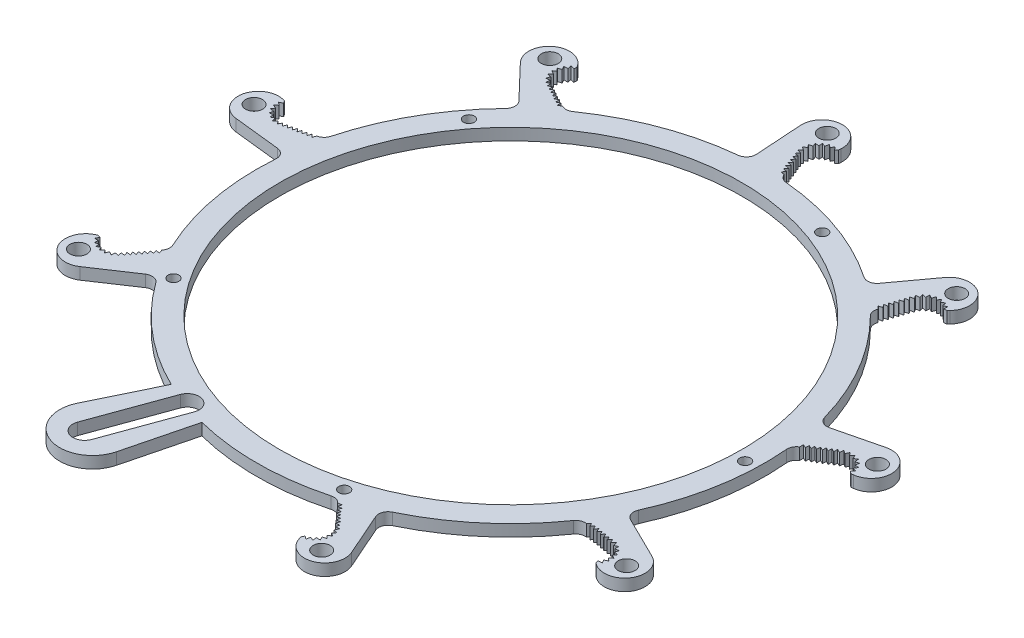
from build123d import *

# Parameters (mm, degrees)
SKETCH1_R           = 68.58
SKETCH1_R_2         = 55.88
BOSS_EXTRUDE1_DEPTH = 3.175
BOSS_EXTRUDE2_START = -3.175
BOSS_EXTRUDE2_DEPTH = 3.175
CIRPATTERN1_COUNT   = 9
SKETCH4_R           = 1.27
CUT_EXTRUDE1_DEPTH  = 126.612114435
CIRPATTERN14_COUNT  = 4
SKETCH5_R           = 62.357
CUT_EXTRUDE2_DEPTH  = 126.612114435
SKETCH7_R           = 1.4605
CUT_EXTRUDE4_DEPTH  = 126.612114435
CIRPATTERN16_COUNT  = 5
CUT_EXTRUDE5_DEPTH  = 126.612114435
CRVPATTERN1_DEPTH   = 3.175
CIRPATTERN17_COUNT  = 9
BOSS_EXTRUDE5_START = -3.175
BOSS_EXTRUDE5_DEPTH = 3.175
SKETCH3_R           = 2.286
CUT_EXTRUDE7_DEPTH  = 126.612114435
CIRPATTERN18_COUNT  = 9
BOSS_EXTRUDE6_START = -3.175
BOSS_EXTRUDE6_DEPTH = 3.175
CUT_EXTRUDE8_DEPTH  = 128.151801464


# Read off the part's stored shape, not the designer's step: CrvPattern1
with BuildPart() as part:
    # Sketch1 → Boss-Extrude1 (new body)
    with BuildSketch(Plane(origin=(0, 0, 0), x_dir=(1, 0, 0), z_dir=(0, 1, 0))):
        with Locations(Location((0, 0, 0), (0, 0, 270))):
            Circle(SKETCH1_R)
        with Locations(Location((0, 0, 0), (0, 0, 270))):
            Circle(SKETCH1_R_2, mode=Mode.SUBTRACT)
    extrude(amount=BOSS_EXTRUDE1_DEPTH)

    # Sketch2 → Boss-Extrude2 (add)
    with BuildSketch(Plane(origin=(0, 3.175, 0), x_dir=(1, 0, 0), z_dir=(0, 1, 0)).offset(BOSS_EXTRUDE2_START)):
        with BuildLine():
            Line((-4.648503105, 70.922452149), (-5.395010683, 82.311956847))
            Line((-5.395010683, 82.311956847), (-5.478072657, 83.579237679))
            ThreePointArc((-5.478072657, 83.579237679), (0, 89.428116328), (5.478072657, 83.579237679))
            Line((5.478072657, 83.579237679), (5.395010683, 82.311956847))
            ThreePointArc((5.395010683, 82.311956847), (1.617293808, 81.120206155), (0.93984527, 77.217325427))
            Line((0.93984527, 77.217325427), (3.81, 69.921657137))
            ThreePointArc((3.81, 69.921657137), (4.653834894, 68.816417694), (5.953179428, 68.321124513))
            ThreePointArc((5.953179428, 68.321124513), (-0.488833742, 68.57825779), (-6.926526743, 68.22931648))
            ThreePointArc((-6.926526743, 68.22931648), (-5.243785443, 69.115963701), (-4.648503105, 70.922452149))
        make_face()
    boss_extrude2 = extrude(amount=BOSS_EXTRUDE2_DEPTH)

    # CirPattern1: Boss-Extrude2 ×9 about axis
    cirpattern1_axis = Axis((0, 0, 0), (0, 1, 0))
    for i in range(1, CIRPATTERN1_COUNT):
        add(boss_extrude2.rotate(cirpattern1_axis, i * 360 / CIRPATTERN1_COUNT))

    # Sketch4 → Cut-Extrude1 (cut, through all)
    with BuildSketch(Plane(origin=(0, 3.175, 0), x_dir=(1, 0, 0), z_dir=(0, 1, 0))):
        with Locations(Location((41.758190963, 41.758190963, 0), (0, 0, 270))):
            Circle(SKETCH4_R)
    cut_extrude1 = extrude(amount=-CUT_EXTRUDE1_DEPTH, mode=Mode.SUBTRACT)

    # CirPattern14: Cut-Extrude1 ×4 about axis
    cirpattern14_axis = Axis((0, 0, 0), (0, 1, 0))
    for i in range(1, CIRPATTERN14_COUNT):
        add(cut_extrude1.rotate(cirpattern14_axis, i * 360 / CIRPATTERN14_COUNT), mode=Mode.SUBTRACT)

    # Sketch5 → Cut-Extrude2 (cut, through all)
    with BuildSketch(Plane(origin=(0, 3.175, 0), x_dir=(1, 0, 0), z_dir=(0, 1, 0))):
        with Locations(Location((0, 0, 0), (0, 0, 270))):
            Circle(SKETCH5_R)
    extrude(amount=-CUT_EXTRUDE2_DEPTH, mode=Mode.SUBTRACT)

    # Sketch7 → Cut-Extrude4 (cut, through all)
    with BuildSketch(Plane(origin=(0, 3.175, 0), x_dir=(1, 0, 0), z_dir=(0, 1, 0))):
        with Locations(Location((22.413264032, 61.579936825, 0), (0, 0, 270))):
            Circle(SKETCH7_R)
    cut_extrude4 = extrude(amount=-CUT_EXTRUDE4_DEPTH, mode=Mode.SUBTRACT)

    # CirPattern16: Cut-Extrude4 ×5 about axis
    cirpattern16_axis = Axis((0, 0, 0), (0, 1, 0))
    for i in range(1, CIRPATTERN16_COUNT):
        add(cut_extrude4.rotate(cirpattern16_axis, i * 360 / CIRPATTERN16_COUNT), mode=Mode.SUBTRACT)

    # Sketch9 → Cut-Extrude5 (cut, through all)
    with BuildSketch(Plane(origin=(0, 3.175, 0), x_dir=(1, 0, 0), z_dir=(0, 1, 0))):
        Polygon((3.492302411, 71.076120273), (3.957242109, 69.894286496), (2.779305238, 70.113251627), align=None)
    cut_extrude5 = extrude(amount=-CUT_EXTRUDE5_DEPTH, mode=Mode.SUBTRACT)

    # CrvPattern1 outline → CrvPattern1 (cut)
    with BuildSketch(Plane(origin=(0, 0, 0), x_dir=(1, 0, 0), z_dir=(0, 1, 0))):
        with BuildLine():
            Line((0.940711797, 77.166791582), (0.329256214, 76.341050005))
            Line((0.329256214, 76.341050005), (1.359950976, 76.149455515))
            Line((1.359950976, 76.149455515), (0.93984527, 77.217325427))
            ThreePointArc((0.93984527, 77.217325427), (1.617293808, 81.120206155), (5.395010683, 82.311956847))
            Line((5.395010683, 82.311956847), (5.44100327, 83.013668123))
            Line((5.44100327, 83.013668123), (4.84878437, 82.438133766))
            Line((4.84878437, 82.438133766), (4.242655964, 83.304873176))
            Line((4.242655964, 83.304873176), (3.729171189, 82.380231497))
            Line((3.729171189, 82.380231497), (2.898698206, 83.03516926))
            Line((2.898698206, 83.03516926), (2.673905231, 82.001681492))
            Line((2.673905231, 82.001681492), (1.689757293, 82.389085266))
            Line((1.689757293, 82.389085266), (1.772785019, 81.334696701))
            Line((1.772785019, 81.334696701), (0.718708814, 81.421600119))
            Line((0.718708814, 81.421600119), (1.102491944, 80.436034617))
            Line((1.102491944, 80.436034617), (0.068184752, 80.215042577))
            Line((0.068184752, 80.215042577), (0.720065018, 79.382167456))
            Line((0.720065018, 79.382167456), (-0.206458139, 78.872085414))
            Line((-0.206458139, 78.872085414), (0.658047102, 78.262774707))
            Line((0.658047102, 78.262774707), (-0.081848948, 77.507008417))
            Line((-0.081848948, 77.507008417), (0.940711797, 77.166791582))
        make_face()
        Polygon((3.401658496, 70.959623533), (2.994836261, 71.993728089), (2.370963734, 71.151218023), align=None)
        Polygon((2.993316992, 71.99758993), (2.586494757, 73.031694485), (1.96262223, 72.189184419), align=None)
        Polygon((2.584975488, 73.035556326), (2.178153253, 74.069660882), (1.554280726, 73.227150816), align=None)
        Polygon((2.176633984, 74.073522723), (1.769811749, 75.107627278), (1.145939222, 74.265117212), align=None)
        Polygon((1.76829248, 75.111489119), (1.361470245, 76.145593674), (0.737597718, 75.303083609), align=None)
    crvpattern1 = extrude(amount=CRVPATTERN1_DEPTH, mode=Mode.SUBTRACT)

    # CirPattern17: Cut-Extrude5, CrvPattern1 ×9 about axis, 1 skipped
    cirpattern17_axis = Axis((0, 0, 0), (0, 1, 0))
    add([cut_extrude5.rotate(cirpattern17_axis, i * 360 / CIRPATTERN17_COUNT) for i in range(1, CIRPATTERN17_COUNT) if i not in (4,)], mode=Mode.SUBTRACT)
    add([crvpattern1.rotate(cirpattern17_axis, i * 360 / CIRPATTERN17_COUNT) for i in range(1, CIRPATTERN17_COUNT) if i not in (4,)], mode=Mode.SUBTRACT)

    # Sketch12 → Boss-Extrude5 (add)
    with BuildSketch(Plane(origin=(0, 3.175, 0), x_dir=(1, 0, 0), z_dir=(0, 1, 0)).offset(BOSS_EXTRUDE5_START)):
        with BuildLine():
            ThreePointArc((-27.494844081, -64.401768499), (-27.585102937, -63.792988052), (-27.819131699, -63.223786127))
            Line((-27.819131699, -63.223786127), (-33.221999006, -75.502736124))
            ThreePointArc((-33.221999006, -75.502736124), (-29.264503593, -75.67491206), (-27.293046374, -72.239104886))
            Line((-27.293046374, -72.239104886), (-27.494844081, -64.401768499))
        make_face()
    extrude(amount=BOSS_EXTRUDE5_DEPTH)

    # Sketch3 → Cut-Extrude7 (cut, through all)
    with BuildSketch(Plane(origin=(0, 3.175, 0), x_dir=(1, 0, 0), z_dir=(0, 1, 0))):
        with Locations(Location((0, 85.364116328, 0), (0, 0, 270))):
            Circle(SKETCH3_R)
    cut_extrude7 = extrude(amount=-CUT_EXTRUDE7_DEPTH, mode=Mode.SUBTRACT)

    # CirPattern18: Cut-Extrude7 ×9 about axis, 1 skipped
    cirpattern18_axis = Axis((0, 0, 0), (0, -1, 0))
    add([cut_extrude7.rotate(cirpattern18_axis, i * 360 / CIRPATTERN18_COUNT) for i in range(1, CIRPATTERN18_COUNT) if i not in (5,)], mode=Mode.SUBTRACT)

    # Sketch15 → Boss-Extrude6 (add)
    with BuildSketch(Plane(origin=(0, 3.175, 0), x_dir=(1, 0, 0), z_dir=(0, 1, 0)).offset(BOSS_EXTRUDE6_START)):
        with BuildLine():
            Line((-33.733487302, -76.665181703), (-27.819131699, -63.223786127))
            ThreePointArc((-27.819131699, -63.223786127), (-28.307061162, -62.604548792), (-28.961359577, -62.164749267))
            ThreePointArc((-28.961359577, -62.164749267), (-29.403730097, -61.956735359), (-29.844606669, -61.745573548))
            Line((-29.844606669, -61.745573548), (-38.098847141, -78.822790138))
            ThreePointArc((-38.098847141, -78.822790138), (-33.136650943, -91.042200221), (-21.48090272, -84.871227262))
            Line((-21.48090272, -84.871227262), (-16.826994534, -66.483596887))
            ThreePointArc((-16.826994534, -66.483596887), (-18.711505325, -66.741241317), (-19.888743183, -68.235186631))
            Line((-19.888743183, -68.235186631), (-23.438078398, -80.412404093))
            ThreePointArc((-23.438078398, -80.412404093), (-30.586217164, -84.034941004), (-33.733487302, -76.665181703))
        make_face()
    extrude(amount=BOSS_EXTRUDE6_DEPTH)

    # Sketch16 → Cut-Extrude8 (cut, through all)
    with BuildSketch(Plane(origin=(0, 3.175, 0), x_dir=(1, 0, 0), z_dir=(0, 1, 0))):
        with BuildLine():
            Line((-20.298471125, -65.052670037), (-27.68268602, -85.34063372))
            ThreePointArc((-27.68268602, -85.34063372), (-31.752124046, -87.238243836), (-33.649734162, -83.16880581))
            Line((-33.649734162, -83.16880581), (-26.265519267, -62.880842127))
            ThreePointArc((-26.265519267, -62.880842127), (-22.196081241, -60.983232011), (-20.298471125, -65.052670037))
        make_face()
    extrude(amount=-CUT_EXTRUDE8_DEPTH, mode=Mode.SUBTRACT)


solid = part.part
